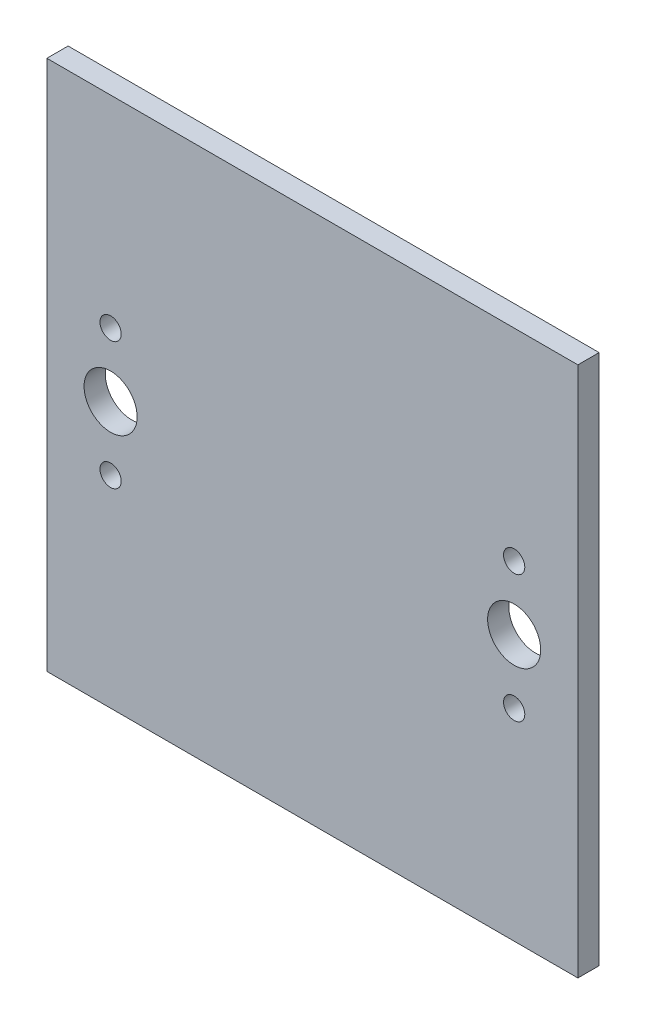
from build123d import *

# Parameters (mm, degrees)
SKETCH1_W                = 50
SKETCH1_H                = 50
PLATE_BODY_DEPTH         = 2
SKETCH2_R                = 2.5
SHAFT_BEARINGS_DEPTH     = 71.738956735
SKETCH3_R                = 1
BEARING_BOLT_HOLES_DEPTH = 71.738956735


with BuildPart() as part:
    # Sketch1 → plate_body (new body)
    with BuildSketch(Plane.XY):
        with Locations((25, 25)):
            Rectangle(SKETCH1_W, SKETCH1_H)
    extrude(amount=PLATE_BODY_DEPTH)

    # Sketch2 → shaft_bearings (cut, through all)
    with BuildSketch(Plane.XY.offset(2)):
        with Locations((6, 25)):
            Circle(SKETCH2_R)
        with Locations((44, 25)):
            Circle(SKETCH2_R)
    extrude(amount=-SHAFT_BEARINGS_DEPTH, mode=Mode.SUBTRACT)

    # Sketch3 → bearing_bolt_holes (cut, through all)
    with BuildSketch(Plane.XY.offset(2)):
        with Locations((6, 31)):
            Circle(SKETCH3_R)
        with Locations((6, 19)):
            Circle(SKETCH3_R)
        with Locations((44, 31)):
            Circle(SKETCH3_R)
        with Locations((44, 19)):
            Circle(SKETCH3_R)
    extrude(amount=-BEARING_BOLT_HOLES_DEPTH, mode=Mode.SUBTRACT)


solid = part.part
